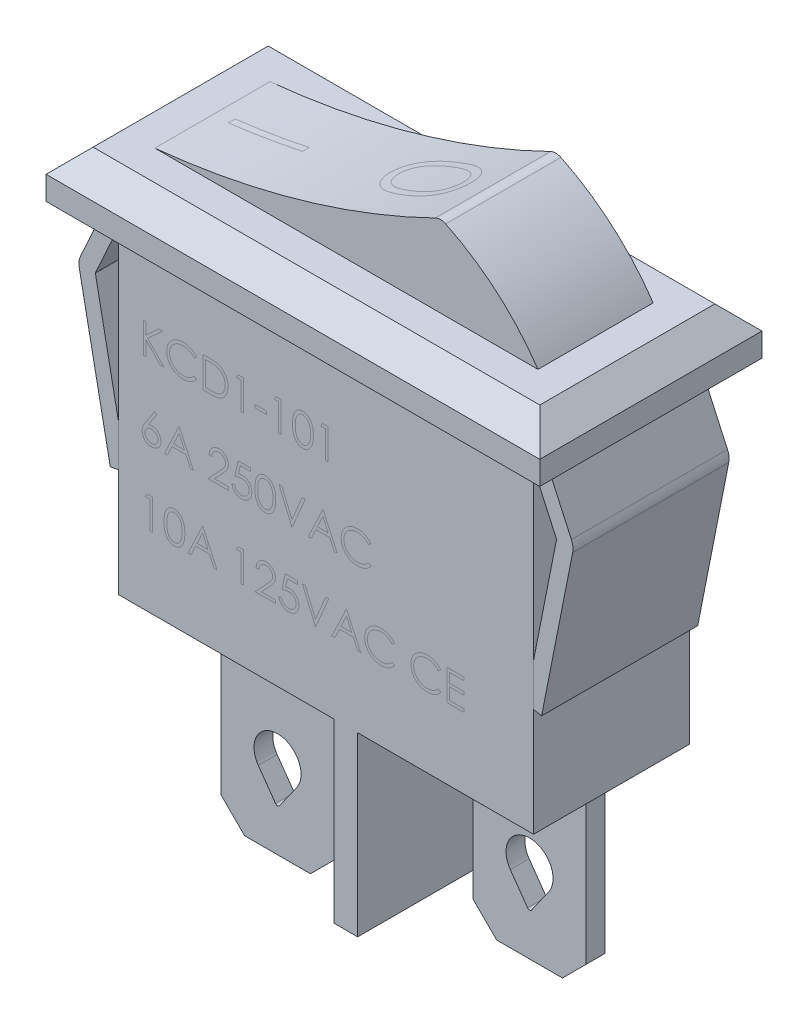
from build123d import *

# Parameters (mm, degrees)
SKETCH1_W               = 17.66
SKETCH1_H               = 14.35
BOSS_EXTRUDE1_DEPTH     = 3.32
SKETCH2_W               = 21
SKETCH2_H               = 9.45
BOSS_EXTRUDE2_DEPTH     = 2
CHAMFER1_SIZE           = 1
BOSS_EXTRUDE3_DEPTH     = 2.45
SKETCH4_W               = 6.64
SKETCH4_H               = 7.52
BOSS_EXTRUDE4_DEPTH     = 1
SKETCH5_W               = 4.8
SKETCH5_H               = 0.8
BOSS_EXTRUDE5_DEPTH     = 8.36
CHAMFER2_SIZE           = 1
CUT_EXTRUDE1_DEPTH      = 20.427903901
CUT_EXTRUDE1_DEPTH_BACK = 20.427903901
EXTRUDE_THIN14_DEPTH    = 3.32
EXTRUDE_THIN14_2_DEPTH  = 3.32
SKETCH10_W              = 17.66
SKETCH10_H              = 14.35
CUT_EXTRUDE5_DEPTH      = 21.407550357


with BuildPart() as part:
    # Sketch1 → Boss-Extrude1 (new, symmetric)
    with BuildSketch(Plane.XY):
        Rectangle(SKETCH1_W, SKETCH1_H)
    extrude(amount=BOSS_EXTRUDE1_DEPTH, both=True)

    # Sketch2 → Boss-Extrude2 (add)
    with BuildSketch(Plane(origin=(0, 7.175, 0), x_dir=(1, 0, 0), z_dir=(0, 1, 0))):
        Rectangle(SKETCH2_W, SKETCH2_H)
    extrude(amount=BOSS_EXTRUDE2_DEPTH)

    # Chamfer1
    chamfer1_edges = [part.edges().sort_by_distance(p)[0] for p in [
        (0, 9.175, -4.725),
        (10.5, 9.175, 0),
        (0, 9.175, 4.725),
        (-10.5, 9.175, 0),
    ]]
    chamfer(chamfer1_edges, length=CHAMFER1_SIZE)

    # Sketch3 → Boss-Extrude3 (add, symmetric)
    with BuildSketch(Plane.XY):
        with BuildLine():
            Line((-8.15, 9.175), (8.15, 9.175))
            ThreePointArc((8.15, 9.175), (6.410868903, 11.13189572), (4.223427445, 12.570338525))
            ThreePointArc((4.223427445, 12.570338525), (4.004542296, 12.620203961), (3.785902119, 12.569275154))
            ThreePointArc((3.785902119, 12.569275154), (-2.030419407, 10.338935291), (-8.15, 9.175))
        make_face()
    extrude(amount=BOSS_EXTRUDE3_DEPTH, both=True)

    # Sketch4 → Boss-Extrude4 (add)
    with BuildSketch(Plane(origin=(0.35, 0, 0), x_dir=(0, 0, -1), z_dir=(1, 0, 0))):
        with Locations((0, -10.935)):
            Rectangle(SKETCH4_W, SKETCH4_H)
    extrude(amount=BOSS_EXTRUDE4_DEPTH)

    # Sketch5 → Boss-Extrude5 (add)
    with BuildSketch(Plane.XZ.offset(7.175)):
        with Locations((4.98, -0.76)):
            Rectangle(SKETCH5_W, SKETCH5_H)
        with Locations((-4.22, 0.76)):
            Rectangle(SKETCH5_W, SKETCH5_H)
    extrude(amount=BOSS_EXTRUDE5_DEPTH)

    # Chamfer2
    chamfer2_edges = [part.edges().sort_by_distance(p)[0] for p in [
        (7.38, -15.535, -0.76),
        (2.58, -15.535, -0.76),
        (-1.82, -15.535, 0.76),
        (-6.62, -15.535, 0.76),
    ]]
    chamfer(chamfer2_edges, length=CHAMFER2_SIZE)

    # Sketch6 → Cut-Extrude1 (cut, two sides: drawn at the far end of the back side and taken through both)
    with BuildSketch(Plane.XY.offset(-0.36).offset(-CUT_EXTRUDE1_DEPTH_BACK)):
        with BuildLine():
            Line((4.898320152, -13.692692308), (4.163201516, -12.651923077))
            ThreePointArc((4.163201516, -12.651923077), (4.98, -11.075), (5.796798484, -12.651923077))
            Line((5.796798484, -12.651923077), (5.061679848, -13.692692308))
            ThreePointArc((5.061679848, -13.692692308), (4.98, -13.735), (4.898320152, -13.692692308))
        make_face()
        with BuildLine():
            Line((-4.301679848, -13.692692308), (-5.036798484, -12.651923077))
            ThreePointArc((-5.036798484, -12.651923077), (-4.22, -11.075), (-3.403201516, -12.651923077))
            Line((-3.403201516, -12.651923077), (-4.138320152, -13.692692308))
            ThreePointArc((-4.138320152, -13.692692308), (-4.22, -13.735), (-4.301679848, -13.692692308))
        make_face()
    extrude(amount=CUT_EXTRUDE1_DEPTH + CUT_EXTRUDE1_DEPTH_BACK, mode=Mode.SUBTRACT)


with BuildPart() as body_2:
    # Sketch9 → Extrude-Thin14 (new, symmetric)
    with BuildSketch(Plane.XY):
        with BuildLine():
            Line((-9.148461691, 7.32019694), (-10.440027607, 4.487394373))
            ThreePointArc((-10.440027607, 4.487394373), (-10.502547518, 4.263250283), (-10.493355659, 4.03073185))
            Line((-10.493355659, 4.03073185), (-9.173348115, -2.642912237))
            Line((-9.173348115, -2.642912237), (-8.486651885, -2.507087763))
            Line((-8.486651885, -2.507087763), (-9.806659429, 4.166556324))
            ThreePointArc((-9.806659429, 4.166556324), (-9.807272219, 4.182057553), (-9.803104225, 4.197000493))
            Line((-9.803104225, 4.197000493), (-8.511538309, 7.02980306))
            Line((-8.511538309, 7.02980306), (-9.148461691, 7.32019694))
        make_face()
    extrude(amount=EXTRUDE_THIN14_DEPTH, both=True)


with BuildPart() as body_3:
    # Sketch9 → Extrude-Thin14 2 (new, symmetric)
    with BuildSketch(Plane.XY):
        with BuildLine():
            Line((8.511538309, 7.02980306), (9.803104225, 4.197000493))
            ThreePointArc((9.803104225, 4.197000493), (9.807272219, 4.182057553), (9.806659429, 4.166556324))
            Line((9.806659429, 4.166556324), (8.486651885, -2.507087763))
            Line((8.486651885, -2.507087763), (9.173348115, -2.642912237))
            Line((9.173348115, -2.642912237), (10.493355659, 4.03073185))
            ThreePointArc((10.493355659, 4.03073185), (10.502547518, 4.263250283), (10.440027607, 4.487394373))
            Line((10.440027607, 4.487394373), (9.148461691, 7.32019694))
            Line((9.148461691, 7.32019694), (8.511538309, 7.02980306))
        make_face()
    extrude(amount=EXTRUDE_THIN14_2_DEPTH, both=True)


with BuildPart() as cut_extrude5_tool:
    # Sketch10 → Cut-Extrude5 (new, through all)
    with BuildSketch(Plane.XY.offset(3.32)):
        Rectangle(SKETCH10_W, SKETCH10_H)
    extrude(amount=-CUT_EXTRUDE5_DEPTH)


with BuildPart() as body_2_1:
    add(body_2.part)

    # Cut-Extrude5: cut by cut_extrude5_tool
    add(cut_extrude5_tool.part, mode=Mode.SUBTRACT)


with BuildPart() as body_3_1:
    add(body_3.part)

    # Cut-Extrude5: cut by cut_extrude5_tool
    add(cut_extrude5_tool.part, mode=Mode.SUBTRACT)


solid = Compound([part.part, body_2_1.part, body_3_1.part])
